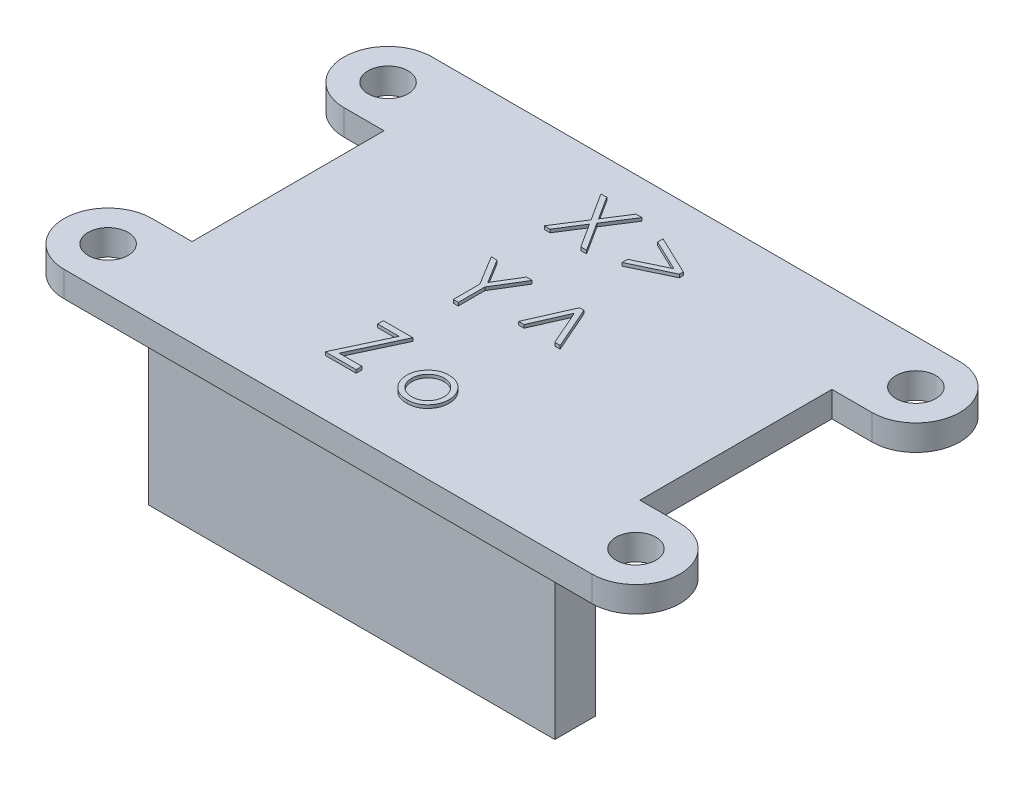
from build123d import *

# Parameters (mm, degrees)
BOSS_EXTRUDE1_DEPTH = 1.6
SKETCH2_R           = 1.25
CUT_EXTRUDE1_DEPTH  = 23.480491543
SKETCH3_W           = 25.4
SKETCH3_H           = 2.54
BOSS_EXTRUDE2_DEPTH = 10
BOSS_EXTRUDE3_DEPTH = 0.2


with BuildPart() as part:
    # Sketch1 → Boss-Extrude1 (new body)
    with BuildSketch(Plane(origin=(0, 0, 0), x_dir=(1, 0, 0), z_dir=(0, 1, 0))):
        with BuildLine():
            Line((-14, 11.5), (-16.5, 11.5))
            ThreePointArc((-16.5, 11.5), (-19.25, 8.75), (-16.5, 6))
            Line((-16.5, 6), (-14, 6))
            Line((-14, 6), (-14, -6))
            Line((-14, -6), (-16.5, -6))
            ThreePointArc((-16.5, -6), (-19.25, -8.75), (-16.5, -11.5))
            Line((-16.5, -11.5), (-14, -11.5))
            Line((-14, -11.5), (14, -11.5))
            Line((14, -11.5), (16.5, -11.5))
            ThreePointArc((16.5, -11.5), (19.25, -8.75), (16.5, -6))
            Line((16.5, -6), (14, -6))
            Line((14, -6), (14, 6))
            Line((14, 6), (16.5, 6))
            ThreePointArc((16.5, 6), (19.25, 8.75), (16.5, 11.5))
            Line((16.5, 11.5), (14, 11.5))
            Line((14, 11.5), (-14, 11.5))
        make_face()
    extrude(amount=BOSS_EXTRUDE1_DEPTH)

    # Sketch2 → Cut-Extrude1 (cut, through all)
    with BuildSketch(Plane(origin=(0, 1.6, 0), x_dir=(1, 0, 0), z_dir=(0, 1, 0))):
        with Locations((-16.5, 8.75)):
            Circle(SKETCH2_R)
        with Locations((16.5, 8.75)):
            Circle(SKETCH2_R)
        with Locations((16.5, -8.75)):
            Circle(SKETCH2_R)
        with Locations((-16.5, -8.75)):
            Circle(SKETCH2_R)
    extrude(amount=-CUT_EXTRUDE1_DEPTH, mode=Mode.SUBTRACT)

    # Sketch3 → Boss-Extrude2 (add)
    with BuildSketch(Plane.XZ):
        with Locations((0, 8.75)):
            Rectangle(SKETCH3_W, SKETCH3_H)
    extrude(amount=BOSS_EXTRUDE2_DEPTH)

    # Sketch4 → Boss-Extrude3 (add)
    # profile 1 of 6: a face of its own
    with BuildSketch(Plane(origin=(0, 1.6, 0), x_dir=(1, 0, 0), z_dir=(0, 1, 0))):
        Polygon((-3.603530873, 9.165262271), (-3.241050905, 9.165262271), (-2.324684719, 7.733571566), (-1.408318533, 9.165262271), (-1.045838565, 9.165262271), (-2.143094174, 7.450318361), (-1.00096677, 5.665262271), (-1.363446738, 5.665262271), (-2.324684719, 7.167065156), (-3.2859227, 5.665262271), (-3.648402668, 5.665262271), (-2.505574142, 7.450318361), align=None)
    # profile 2 of 6: a face of its own
    with BuildSketch(Plane(origin=(0, 1.6, 0), x_dir=(1, 0, 0), z_dir=(0, 1, 0))):
        Polygon((0.771469127, 6.455426534), (2.736012396, 7.392826374), (0.771469127, 8.330226214), (0.771469127, 8.671672528), (3.19454605, 7.515522688), (3.19454605, 7.27013006), (0.771469127, 6.11398022), align=None)
    # profile 3 of 6: a face of its own
    with BuildSketch(Plane(origin=(0, 1.6, 0), x_dir=(1, 0, 0), z_dir=(0, 1, 0))):
        Polygon((-3.62596677, 2.331928938), (-3.26629129, 2.331928938), (-2.346419495, 0.828022688), (-1.427949944, 2.331928938), (-1.068274463, 2.331928938), (-2.190069335, 0.495690957), (-2.190069335, -1.168071062), (-2.504171899, -1.168071062), (-2.504171899, 0.495690957), align=None)
    # profile 4 of 6: a face of its own
    with BuildSketch(Plane(origin=(0, 1.6, 0), x_dir=(1, 0, 0), z_dir=(0, 1, 0))):
        Polygon((1.893263999, 2.331928938), (2.162494768, 2.331928938), (3.329161435, -0.315506959), (2.990519608, -0.315506959), (2.027879383, 1.868487432), (1.065239159, -0.315506959), (0.726597332, -0.315506959), align=None)
    # profile 5 of 6: a face of its own
    with BuildSketch(Plane(origin=(0, 1.6, 0), x_dir=(1, 0, 0), z_dir=(0, 1, 0))):
        Polygon((-3.536223181, -4.860378754), (-3.536223181, -4.501404395), (-1.696479591, -4.501404395), (-3.164628629, -7.642430036), (-1.741351386, -7.642430036), (-1.741351386, -8.001404395), (-3.670838565, -8.001404395), (-2.202689527, -4.860378754), align=None)
    # profile 6 of 6: a face of its own
    with BuildSketch(Plane(origin=(0, 1.6, 0), x_dir=(1, 0, 0), z_dir=(0, 1, 0))):
        with BuildLine():
            add(Edge.make_bspline(
                [(1.468384191, -5.398840293), (1.516375464, -5.399862184), (1.610474622, -5.401865863), (1.748282507, -5.423280828), (1.879827643, -5.456028193), (2.005613835, -5.501299755), (2.124030131, -5.561981705), (2.236801375, -5.634390996), (2.343618384, -5.72017359), (2.407641413, -5.786531658), (2.440138999, -5.820214492)],
                knots=[0, 0, 0, 0, 1.054011418, 2.066658804, 3.057071809, 4.030435133, 4.997543892, 5.974964718, 6.972108034, 8, 8, 8, 8], degree=3))
            add(Edge.make_bspline(
                [(2.440138999, -5.820214492), (2.468120953, -5.852428477), (2.523543333, -5.91623302), (2.594609052, -6.019688632), (2.655830612, -6.126828733), (2.704893573, -6.23907606), (2.743578597, -6.355450731), (2.771044293, -6.476352742), (2.787381228, -6.601515089), (2.789584195, -6.686518927), (2.790699896, -6.729569459)],
                knots=[0, 0, 0, 0, 1.025258237, 2.030674902, 3.01204498, 3.988269485, 4.97094183, 5.956517959, 6.965070386, 8, 8, 8, 8], degree=3))
            add(Edge.make_bspline(
                [(2.790699896, -6.729569459), (2.789718559, -6.772869517), (2.787779391, -6.85843245), (2.769435774, -6.984451816), (2.740904688, -7.106646639), (2.70007285, -7.224505333), (2.647714741, -7.33838816), (2.583824053, -7.447797709), (2.507952436, -7.552949843), (2.421948439, -7.652951681), (2.326896563, -7.745117896), (2.223780415, -7.825446165), (2.114626381, -7.89426769), (1.997983028, -7.949704105), (1.874915541, -7.993413806), (1.745158473, -8.024113822), (1.608913403, -8.042675506), (1.515886181, -8.045059079), (1.468384191, -8.04627619)],
                knots=[0, 0, 0, 0, 0.998656419, 1.973391657, 2.932242238, 3.890759089, 4.846373663, 5.82037756, 6.809684879, 7.83454468, 8.860553229, 9.859544525, 10.845671541, 11.83227036, 12.833544569, 13.85385346, 14.904124723, 16, 16, 16, 16], degree=3))
            add(Edge.make_bspline(
                [(1.468384191, -8.04627619), (1.420649472, -8.045054994), (1.327158612, -8.04266322), (1.19043263, -8.024185937), (1.060443011, -7.993427954), (0.937214412, -7.949560461), (0.820069566, -7.894265918), (0.710283069, -7.825654228), (0.607083153, -7.745094073), (0.512011169, -7.652958136), (0.426012563, -7.55294818), (0.350139555, -7.447798141), (0.286249229, -7.338388048), (0.233891025, -7.224505363), (0.193059212, -7.106646631), (0.164528119, -6.984451818), (0.146184505, -6.85843245), (0.144245336, -6.772869517), (0.143263999, -6.729569459)],
                knots=[0, 0, 0, 0, 1.099876186, 2.154163076, 3.173186993, 4.173200201, 5.163417411, 6.152872554, 7.150605724, 8.17532212, 9.198891216, 10.186952605, 11.159729845, 12.11414092, 13.071450619, 14.029093627, 15.002601286, 16, 16, 16, 16], degree=3))
            add(Edge.make_bspline(
                [(0.143263999, -6.729569459), (0.144387309, -6.686752914), (0.146611271, -6.601983511), (0.16293178, -6.477056451), (0.190290336, -6.356359061), (0.229021733, -6.240433585), (0.278536924, -6.128678149), (0.338898211, -6.021273318), (0.410688844, -5.918285518), (0.465890796, -5.854563438), (0.493824896, -5.822317857)],
                knots=[0, 0, 0, 0, 1.031353054, 2.041901799, 3.029428768, 4.008703097, 4.981709435, 5.96992636, 6.972712378, 8, 8, 8, 8], degree=3))
            add(Edge.make_bspline(
                [(0.493824896, -5.822317857), (0.526273487, -5.788342918), (0.590089351, -5.721525221), (0.697438079, -5.635992697), (0.8099319, -5.562076623), (0.929656826, -5.502600408), (1.055339684, -5.45576189), (1.187558927, -5.423196375), (1.325834442, -5.40194302), (1.420394063, -5.399884842), (1.468384191, -5.398840293)],
                knots=[0, 0, 0, 0, 1.027980169, 2.021703884, 2.998553061, 3.971491411, 4.943284454, 5.930300938, 6.949603206, 8, 8, 8, 8], degree=3))
        make_face()
        with BuildLine():
            add(Edge.make_bspline(
                [(1.466981948, -5.712942857), (1.433044336, -5.713907449), (1.366045208, -5.715811731), (1.267425623, -5.730295636), (1.172485469, -5.75324314), (1.081044625, -5.785847196), (0.993411452, -5.827946095), (0.90950205, -5.879654455), (0.82906961, -5.940287412), (0.753687547, -6.009750083), (0.684505235, -6.085629078), (0.624027258, -6.166477437), (0.572602152, -6.250983783), (0.529761993, -6.339235994), (0.497854805, -6.432128408), (0.474681782, -6.528609039), (0.460211542, -6.628874456), (0.458325163, -6.697035474), (0.457366563, -6.731672825)],
                knots=[0, 0, 0, 0, 1.021534396, 2.016698045, 2.994645724, 3.958388632, 4.93408049, 5.916473867, 6.921342795, 7.962252576, 8.998418191, 10.008913653, 10.997312074, 11.973003931, 12.956656626, 13.948281152, 14.957379055, 16, 16, 16, 16], degree=3))
            add(Edge.make_bspline(
                [(0.457366563, -6.731672825), (0.458973387, -6.776424852), (0.462162631, -6.865249258), (0.488097867, -6.99606038), (0.531484147, -7.121642232), (0.590071427, -7.241258618), (0.663477646, -7.351930896), (0.749964712, -7.450602381), (0.848604413, -7.535788192), (0.958220913, -7.606469038), (1.076575231, -7.662628793), (1.201831552, -7.702427769), (1.332472246, -7.728299462), (1.421752977, -7.730870936), (1.466981948, -7.732173626)],
                knots=[0, 0, 0, 0, 1.016792936, 2.018143844, 3.017858371, 4.030088057, 5.03801393, 6.028138512, 7.003788237, 7.991172063, 8.984598303, 9.972568034, 10.972917682, 12, 12, 12, 12], degree=3))
            add(Edge.make_bspline(
                [(1.466981948, -7.732173626), (1.512208316, -7.730863346), (1.601483912, -7.728276889), (1.731943089, -7.702558069), (1.856857061, -7.662454409), (1.975088449, -7.606532199), (2.084655052, -7.535519784), (2.184004173, -7.451083407), (2.269752785, -7.351669556), (2.343086389, -7.241112027), (2.402633132, -7.121827675), (2.445816334, -6.996037202), (2.47181392, -6.86525516), (2.474994749, -6.77642683), (2.476597332, -6.731672825)],
                knots=[0, 0, 0, 0, 1.02726834, 2.027799167, 3.010890988, 4.004497153, 4.992059811, 5.971914811, 6.958719428, 7.966827853, 8.981595046, 9.981490638, 10.983022906, 12, 12, 12, 12], degree=3))
            add(Edge.make_bspline(
                [(2.476597332, -6.731672825), (2.475639062, -6.697035267), (2.473753333, -6.628873841), (2.459278369, -6.528611388), (2.436122829, -6.432119791), (2.404151212, -6.339267788), (2.361497198, -6.250755284), (2.309080405, -6.166725557), (2.248849379, -6.085349011), (2.178832258, -6.00999537), (2.103528881, -5.940260333), (2.023063842, -5.879630944), (1.939278864, -5.828173348), (1.851900281, -5.785487108), (1.760447714, -5.753539767), (1.665640584, -5.730163136), (1.567441774, -5.715872939), (1.500682731, -5.713925798), (1.466981948, -5.712942857)],
                knots=[0, 0, 0, 0, 1.042956736, 2.052379634, 3.044323526, 4.02829302, 5.004299113, 5.996692471, 7.007513377, 8.048758398, 9.090003419, 10.095195979, 11.07790575, 12.047570684, 13.018257071, 13.989683339, 14.985167495, 16, 16, 16, 16], degree=3))
        make_face(mode=Mode.SUBTRACT)
    extrude(amount=BOSS_EXTRUDE3_DEPTH)


solid = part.part
